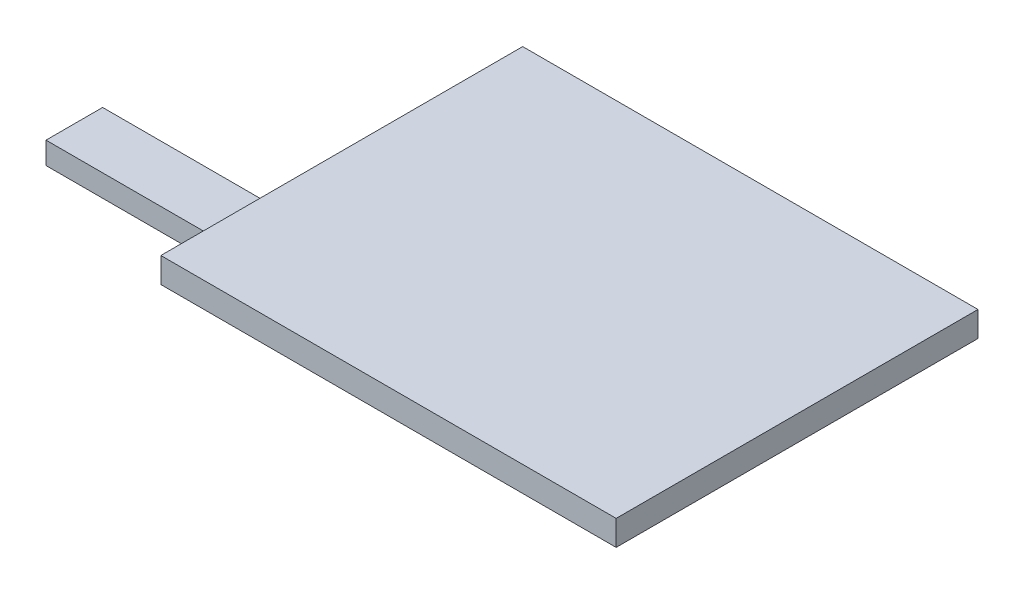
from build123d import *

# Parameters (mm, degrees)
SKETCH1_W           = 144.7
SKETCH1_H           = 8
BOSS_EXTRUDE1_DEPTH = 115
SKETCH3_W           = 10
SKETCH3_H           = 18
BOSS_EXTRUDE2_DEPTH = 14
SKETCH4_W           = 18
SKETCH4_H           = 7
BOSS_EXTRUDE6_DEPTH = 65
BOSS_EXTRUDE9_DEPTH = 10


with BuildPart() as part:
    # Sketch1 → Boss-Extrude1 (new body)
    with BuildSketch(Plane.XY):
        with Locations((34.899775573, 7.072761635)):
            Rectangle(SKETCH1_W, SKETCH1_H)
    extrude(amount=BOSS_EXTRUDE1_DEPTH)

    # Sketch3 → Boss-Extrude2 (add)
    with BuildSketch(Plane.XZ.offset(-3.072761635)):
        with Locations((-32.450224427, 77.5)):
            Rectangle(SKETCH3_W, SKETCH3_H)
    extrude(amount=BOSS_EXTRUDE2_DEPTH)

    # Sketch4 → Boss-Extrude6 (add)
    with BuildSketch(Plane.ZY.offset(37.450224427)):
        with Locations((77.5, -7.427238365)):
            Rectangle(SKETCH4_W, SKETCH4_H)
    extrude(amount=BOSS_EXTRUDE6_DEPTH)

    # Sketch7 → Boss-Extrude9 (add)
    with BuildSketch(Plane.YZ.offset(-27.450224427)):
        with BuildLine():
            Line((3.072761635, 86.5), (3.072761635, 98.5))
            ThreePointArc((3.072761635, 98.5), (-5.392664772, 94.209664141), (-10.927238365, 86.5))
            Line((-10.927238365, 86.5), (3.072761635, 86.5))
        make_face()
        with BuildLine():
            Line((3.072761635, 68.5), (3.072761635, 56.5))
            ThreePointArc((3.072761635, 56.5), (-5.392664772, 60.790335859), (-10.927238365, 68.5))
            Line((-10.927238365, 68.5), (3.072761635, 68.5))
        make_face()
    extrude(amount=-BOSS_EXTRUDE9_DEPTH)


solid = part.part
